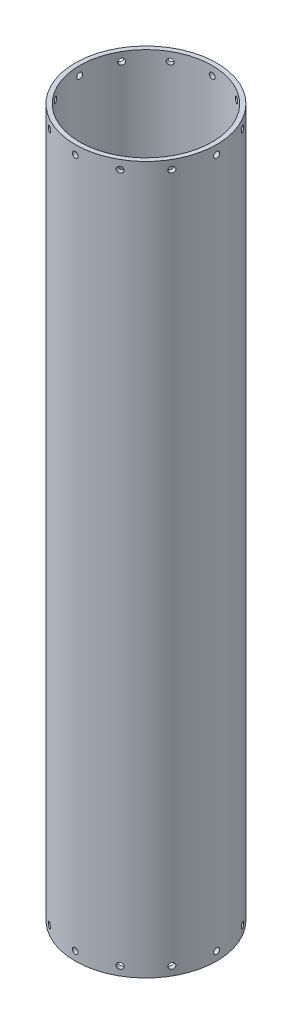
from build123d import *

# Parameters (mm, degrees)
SKETCH1_R                 = 76.2
SKETCH1_R_2               = 71.4375
INNER_OUTERDIAMETER_DEPTH = 762
SKETCH2_R                 = 3.175
TOP_BOTTOMBOLTHOLES_DEPTH = 770.582276303
CIRPATTERN1_COUNT         = 12


with BuildPart() as part:
    # Sketch1 → Inner&OuterDiameter (new body)
    with BuildSketch(Plane(origin=(0, 0, 0), x_dir=(1, 0, 0), z_dir=(0, 1, 0))):
        Circle(SKETCH1_R)
        Circle(SKETCH1_R_2, mode=Mode.SUBTRACT)
    extrude(amount=INNER_OUTERDIAMETER_DEPTH)

    # Sketch2 → Top&BottomBoltHoles (cut, through all)
    with BuildSketch(Plane.XY):
        with Locations((0, 752.475)):
            Circle(SKETCH2_R)
        with Locations((0, 9.525)):
            Circle(SKETCH2_R)
    top_bottomboltholes = extrude(amount=-TOP_BOTTOMBOLTHOLES_DEPTH, mode=Mode.SUBTRACT)

    # CirPattern1: Top&BottomBoltHoles ×12 about axis
    cirpattern1_axis = Axis((0, 762, 0), (0, -1, 0))
    for i in range(1, CIRPATTERN1_COUNT):
        add(top_bottomboltholes.rotate(cirpattern1_axis, i * 360 / CIRPATTERN1_COUNT), mode=Mode.SUBTRACT)


solid = part.part
